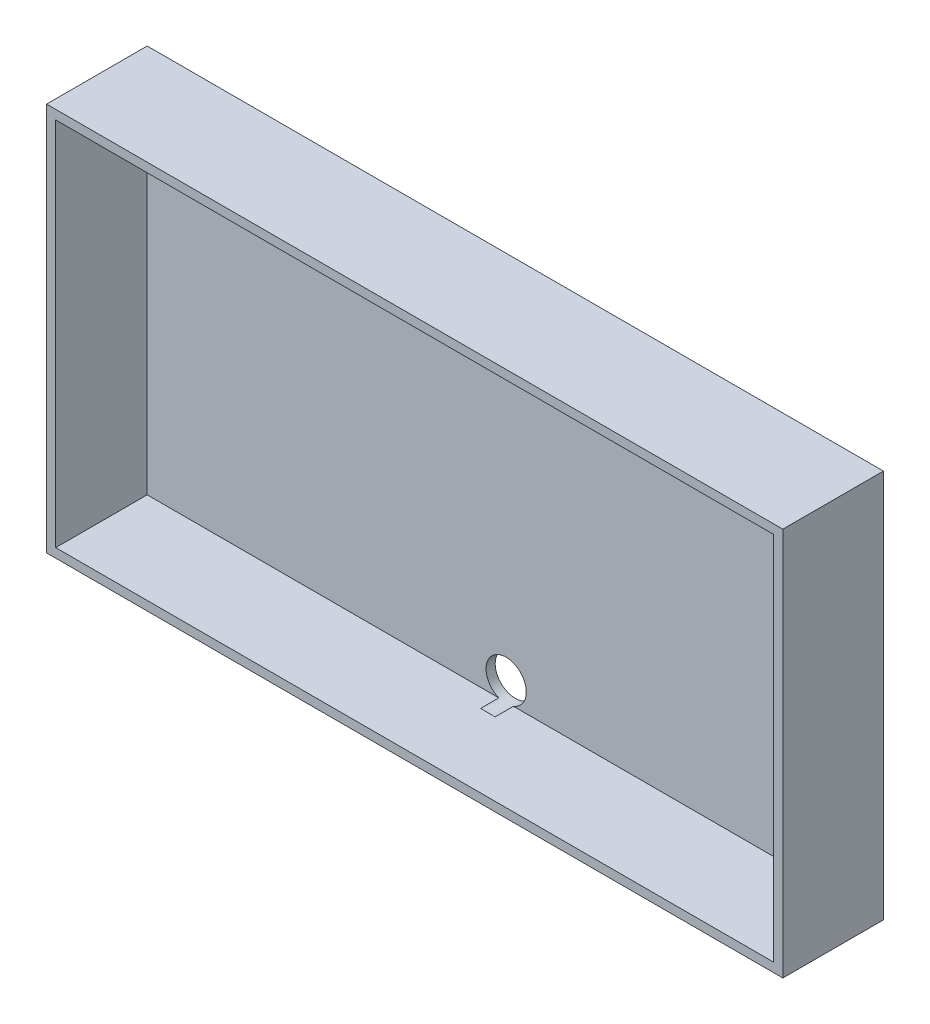
from build123d import *

# Parameters (mm, degrees)
SKETCH1_W           = 80.5
SKETCH1_H           = 42.5
BOSS_EXTRUDE1_DEPTH = 11
SKETCH2_W           = 78.5
SKETCH2_H           = 40.5
CUT_EXTRUDE1_DEPTH  = 10
SKETCH3_R           = 2.2
CUT_EXTRUDE2_DEPTH  = 3


with BuildPart() as part:
    # Sketch1 → Boss-Extrude1 (new body)
    with BuildSketch(Plane.XY):
        with Locations((40.25, -21.25)):
            Rectangle(SKETCH1_W, SKETCH1_H)
    extrude(amount=BOSS_EXTRUDE1_DEPTH)

    # Sketch2 → Cut-Extrude1 (cut)
    with BuildSketch(Plane.XY.offset(11)):
        with Locations((40.25, -21.25)):
            Rectangle(SKETCH2_W, SKETCH2_H)
    extrude(amount=-CUT_EXTRUDE1_DEPTH, mode=Mode.SUBTRACT)

    # Sketch3 → Cut-Extrude2 (cut)
    with BuildSketch(Plane(origin=(0, 0, 0), x_dir=(-1, 0, 0), z_dir=(0, 0, -1))):
        with Locations((-40.25, -39.45)):
            Circle(SKETCH3_R)
        with Locations((-40.25, -3.05)):
            Circle(SKETCH3_R)
    extrude(amount=-CUT_EXTRUDE2_DEPTH, mode=Mode.SUBTRACT)


solid = part.part
